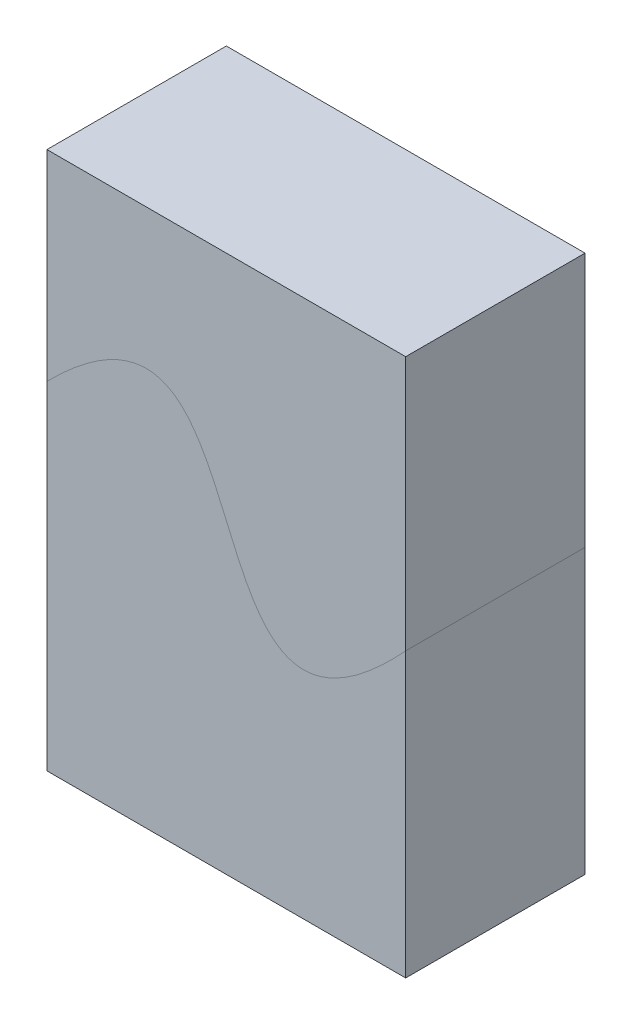
from build123d import *

# Parameters (mm, degrees)
SKETCH2_W           = 40
SKETCH2_H           = 60
BOSS_EXTRUDE1_DEPTH = 20
SPLIT1_DEPTH        = 20
SPLIT1_2_DEPTH      = 20


# Read off the part's stored shape, not the designer's step: Split1
with BuildPart() as part:
    # Sketch2 → Boss-Extrude1 (new body)
    with BuildSketch(Plane.XY):
        with Locations((20, 30)):
            Rectangle(SKETCH2_W, SKETCH2_H)
    extrude(amount=BOSS_EXTRUDE1_DEPTH)

    # Split1 2 outline → Split1 2 (cut)
    with BuildSketch(Plane.XY):
        with BuildLine():
            Line((0, 60), (0, 37.615851309))
            add(Edge.make_bspline(
                [(0, 37.615851309), (25.792545387, 63.78325659), (14.38564364, 3.838292105), (40, 31.589340599)],
                knots=[0, 0, 0, 0, 1, 1, 1, 1], degree=3))
            Line((40, 31.589340599), (40, 60))
            Line((40, 60), (0, 60))
        make_face()
    extrude(amount=SPLIT1_2_DEPTH, mode=Mode.SUBTRACT)


with BuildPart() as body_2:
    # Split1 outline → Split1 (new body)
    with BuildSketch(Plane.XY):
        with BuildLine():
            Line((0, 60), (0, 37.615851309))
            add(Edge.make_bspline(
                [(0, 37.615851309), (25.792545387, 63.78325659), (14.38564364, 3.838292105), (40, 31.589340599)],
                knots=[0, 0, 0, 0, 1, 1, 1, 1], degree=3))
            Line((40, 31.589340599), (40, 60))
            Line((40, 60), (0, 60))
        make_face()
    extrude(amount=SPLIT1_DEPTH)


solid = Compound([part.part, body_2.part])
